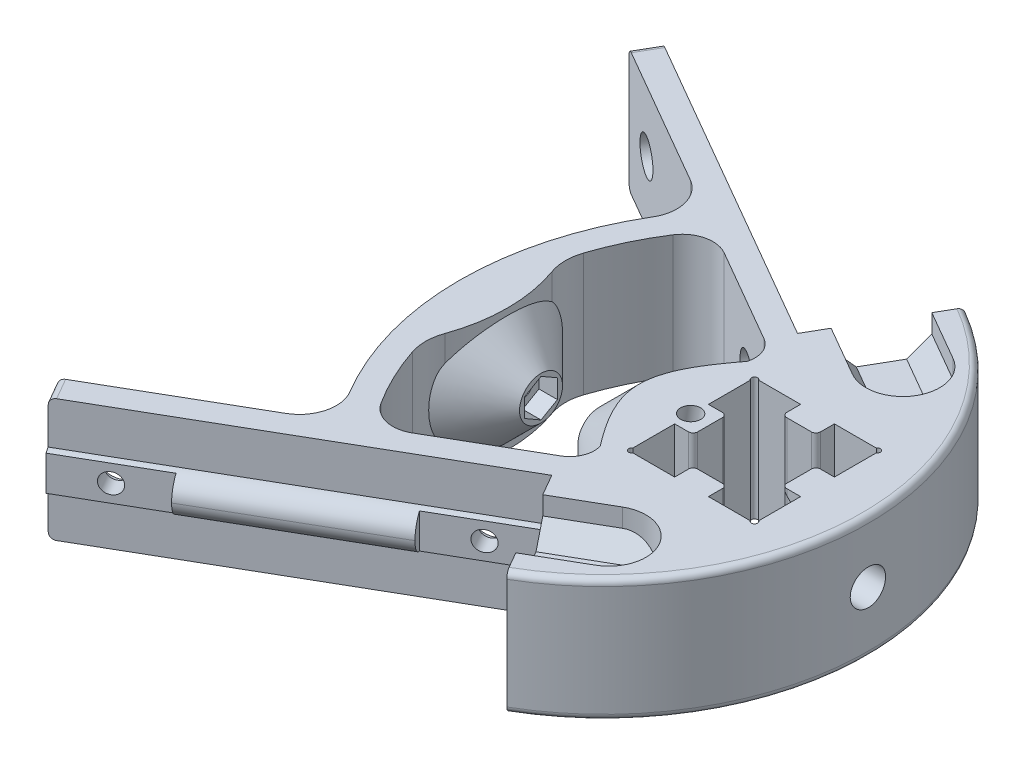
from build123d import *

# Parameters (mm, degrees)
BOSS_EXTRUDE1_DEPTH      = 10
BOSS_EXTRUDE1_DEPTH_BACK = 10
CUT_EXTRUDE1_DEPTH       = 85.16558516883241
CUT_EXTRUDE1_DEPTH_BACK  = 85.16558516883241
CUT_EXTRUDE2_DEPTH       = 15.5
FILLET1_R                = 6
BOSS_EXTRUDE2_DEPTH      = 3
SKETCH7_W                = 15.499999999999996
SKETCH7_H                = 6.0000000000000275
CUT_EXTRUDE6_DEPTH       = 2
SKETCH8_R                = 1.6250000000000036
SKETCH8_R_2              = 1.6250000000000004
CUT_EXTRUDE7_DEPTH       = 91.43091285616889
SKETCH9_R                = 2.8750000000000013
SKETCH9_R_2              = 2.874999999999998
CUT_EXTRUDE8_DEPTH       = 2
FILLET3_R                = 3
FILLET3_OF_MIRROR4_R     = 3
SKETCH10_R               = 1.6250000000000004
CUT_EXTRUDE9_DEPTH       = 91.52459814041141
SKETCH11_W               = 5.500000000000943
SKETCH11_H               = 15.5
CUT_EXTRUDE11_DEPTH      = 2
SKETCH13_R               = 2.875
CUT_EXTRUDE12_DEPTH      = 7.297005384
CUT_EXTRUDE19_REACH      = 88.363
FILLET8_R                = 1
BOSS_EXTRUDE4_START      = -10
BOSS_EXTRUDE4_DEPTH      = 20
CUT_EXTRUDE16_DEPTH      = 15
CUT_EXTRUDE16_DEPTH_BACK = 76.53611051598217
SKETCH22_R               = 1.625
CUT_EXTRUDE17_DEPTH      = 3
CUT_EXTRUDE23_DEPTH      = 77.66001895829943
CUT_EXTRUDE18_START      = -8.260694126
SKETCH24_R               = 2.875
CUT_EXTRUDE18_DEPTH      = 8.260694126
BOSS_EXTRUDE5_REACH      = 86.786
SKETCH26_R               = 3.5
SKETCH33_W               = 3.175991156796007
SKETCH33_H               = 3.160348597481216
SKETCH33_W_2             = 2.9170878472882418
SKETCH33_H_2             = 3.188535845757045
CUT_EXTRUDE24_DEPTH      = 87.43609356738901


with BuildPart() as part:
    # Sketch-main → Boss-Extrude1 (new, two sides: drawn at the far end of the back side and taken through both)
    with BuildSketch(Plane(origin=(0, 0, 0), x_dir=(1, 0, 0), z_dir=(0, 1, 0)).offset(-BOSS_EXTRUDE1_DEPTH_BACK)):
        with BuildLine():
            Line((-13.000000000000002, 20), (-64.96152422706649, 49.99999999999968))
            Line((-64.96152422706649, 49.99999999999968), (-66.96152422706649, 46.53589838486192))
            Line((-66.96152422706649, 46.53589838486192), (-15.004001400732033, 16.538208594652033))
            ThreePointArc((-15.004001400732033, 16.538208594652033), (-13.123100608335006, 14.042925352364557), (-13.610574402880538, 10.956406998343017))
            ThreePointArc((-13.610574402880538, 10.956406998343017), (-16.748819076269225, -6.66e-15), (-13.610574402880461, -10.956406998342983))
            ThreePointArc((-13.610574402880461, -10.956406998342983), (-13.12310060833493, -14.042925352364582), (-15.004001400732033, -16.538208594652033))
            Line((-15.004001400732033, -16.538208594652033), (-66.96152422706648, -46.53589838486191))
            Line((-66.96152422706648, -46.53589838486191), (-64.96152422706649, -49.99999999999968))
            Line((-64.96152422706649, -49.99999999999968), (-13.000000000000002, -20))
            Line((-13.000000000000002, -20), (-3.0000000000001115, -37.320508075688835))
            ThreePointArc((-3.0000000000001115, -37.320508075688835), (18.547005383792598, -9.57e-15), (-3.0000000000001066, 37.320508075688835))
            Line((-3.0000000000001066, 37.320508075688835), (-13.000000000000002, 20))
        make_face()
    extrude(amount=BOSS_EXTRUDE1_DEPTH + BOSS_EXTRUDE1_DEPTH_BACK)

    # Sketch-extrusion profile → Cut-Extrude1 (cut, two sides: drawn at the far end of the back side and taken through both)
    with BuildSketch(Plane(origin=(0, 0, 0), x_dir=(1, 0, 0), z_dir=(0, 1, 0)).offset(-CUT_EXTRUDE1_DEPTH_BACK)):
        with BuildLine():
            Line((10.250000000000622, 2.75000000000047), (10.250000000000616, 9.566987298108355))
            ThreePointArc((10.250000000000616, 9.566987298108355), (10.353553390593937, 10.353553390593861), (9.566987298108396, 10.250000000000574))
            Line((9.566987298108396, 10.250000000000574), (2.7500000000005236, 10.250000000000599))
            Line((2.7500000000005236, 10.250000000000599), (2.7500000000005236, 8.000000000000595))
            ThreePointArc((2.7500000000005236, 8.000000000000595), (2.5303300858904327, 7.469669914110679), (2.000000000000515, 7.2500000000005915))
            Line((2.000000000000515, 7.2500000000005915), (0, 7.2500000000005995))
            Line((0, 7.2500000000005995), (-2.0000000000004903, 7.2500000000005995))
            ThreePointArc((-2.0000000000004903, 7.2500000000005995), (-2.5303300858904065, 7.469669914110688), (-2.750000000000498, 8.000000000000604))
            Line((-2.750000000000498, 8.000000000000604), (-2.750000000000498, 10.250000000000611))
            Line((-2.750000000000498, 10.250000000000611), (-9.56698729810839, 10.250000000000611))
            ThreePointArc((-9.56698729810839, 10.250000000000611), (-10.353553390593884, 10.353553390593884), (-10.250000000000611, 9.56698729810839))
            Line((-10.250000000000611, 9.56698729810839), (-10.25000000000061, 2.750000000000496))
            Line((-10.25000000000061, 2.750000000000496), (-8.000000000000606, 2.750000000000496))
            ThreePointArc((-8.000000000000606, 2.750000000000496), (-7.469669914110688, 2.5303300858904074), (-7.250000000000598, 2.000000000000491))
            Line((-7.250000000000598, 2.000000000000491), (-7.250000000000598, -1.73e-15))
            Line((-7.250000000000598, -1.73e-15), (-7.250000000000598, -2.0000000000004174))
            ThreePointArc((-7.250000000000598, -2.0000000000004174), (-7.4696699141107, -2.5303300858903466), (-8.000000000000634, -2.7500000000004134))
            Line((-8.000000000000634, -2.7500000000004134), (-10.250000000000645, -2.7500000000004134))
            Line((-10.250000000000645, -2.7500000000004134), (-10.250000000000645, -9.566987298108245))
            ThreePointArc((-10.250000000000645, -9.566987298108245), (-10.35355339059406, -10.353553390593706), (-9.566987298108558, -10.250000000000615))
            Line((-9.566987298108558, -10.250000000000615), (-2.750000000000581, -10.250000000000577))
            Line((-2.750000000000581, -10.250000000000577), (-2.750000000000581, -8.000000000000574))
            ThreePointArc((-2.750000000000581, -8.000000000000574), (-2.530330085890485, -7.469669914110661), (-2.0000000000005667, -7.250000000000577))
            Line((-2.0000000000005667, -7.250000000000577), (-4.888e-14, -7.2500000000005995))
            Line((-4.888e-14, -7.2500000000005995), (2.000000000000441, -7.2500000000005995))
            ThreePointArc((2.000000000000441, -7.2500000000005995), (2.5303300858903652, -7.469669914110696), (2.7500000000004414, -8.000000000000624))
            Line((2.7500000000004414, -8.000000000000624), (2.7500000000004414, -10.250000000000632))
            Line((2.7500000000004414, -10.250000000000632), (9.566987298108364, -10.250000000000648))
            ThreePointArc((9.566987298108364, -10.250000000000648), (10.353553390593767, -10.353553390593923), (10.25000000000058, -9.56698729810843))
            Line((10.25000000000058, -9.56698729810843), (10.250000000000588, -2.7500000000005516))
            Line((10.250000000000588, -2.7500000000005516), (8.000000000000584, -2.7500000000005516))
            ThreePointArc((8.000000000000584, -2.7500000000005516), (7.46966991411067, -2.5303300858904585), (7.250000000000585, -2.0000000000005405))
            Line((7.250000000000585, -2.0000000000005405), (7.2500000000005995, -2.444e-14))
            Line((7.2500000000005995, -2.444e-14), (7.2500000000005995, 2.000000000000466))
            ThreePointArc((7.2500000000005995, 2.000000000000466), (7.469669914110693, 2.530330085890386), (8.000000000000615, 2.7500000000004694))
            Line((8.000000000000615, 2.7500000000004694), (10.250000000000622, 2.75000000000047))
        make_face()
    extrude(amount=CUT_EXTRUDE1_DEPTH + CUT_EXTRUDE1_DEPTH_BACK, mode=Mode.SUBTRACT)

    # Sketch1 → Cut-Extrude2 (cut)
    with BuildSketch(Plane(origin=(-18.410254037844403, 0, -10.629165124598712), x_dir=(-0.4999999999999947, 0, 0.8660254037844417), z_dir=(-0.8660254037844418, 0, -0.49999999999999484))):
        Polygon((-17.820508075688895, 4), (-23.82050807568889, 4), (-26.820508075688892, 6.999999999999999), (-26.820508075688892, 9.999999999999998), (-14.820508075688894, 10), (-14.820508075688892, 7.000000000000001), align=None)
        Polygon((-23.820508075688885, -4), (-26.82050807568889, -7.000000000000003), (-26.820508075688892, -9.999999999999998), (-14.820508075688888, -9.999999999999996), (-14.820508075688892, -7.000000000000001), (-17.820508075688895, -4), align=None)
    cut_extrude2 = extrude(amount=-CUT_EXTRUDE2_DEPTH, mode=Mode.SUBTRACT)

    # Mirror1: Cut-Extrude2 across plane
    add(cut_extrude2.mirror(Plane.XY), mode=Mode.SUBTRACT)

    # Fillet1
    fillet1_edges = [part.edges().sort_by_distance(p)[0] for p in [
        (2.4233937586588157, -8.499999999999998, 15.71410161513785),
        (8.423393758658756, -8.5, 26.10640646055115),
        (2.4233937586588175, 8.5, 15.71410161513785),
        (8.423393758658756, 8.499999999999998, 26.10640646055115),
        (2.423393758658812, -8.499999999999998, -15.714101615137842),
        (8.423393758658749, -8.5, -26.106406460551145),
        (8.423393758658749, 8.499999999999998, -26.106406460551145),
        (2.423393758658813, 8.5, -15.714101615137844),
    ]]
    fillet(fillet1_edges, radius=FILLET1_R - 0.0001)  # a hair under: the kernel refuses the full size

    # Sketch3 → Boss-Extrude2 (add)
    with BuildSketch(Plane(origin=(5.410254037844397, 0, -9.370834875401297), x_dir=(-0.8660254037844417, 0, -0.4999999999999947), z_dir=(0.49999999999999484, 0, -0.8660254037844418))):
        Polygon((21.25833024919736, -3.000000000000001), (81.25833024919763, -3.000000000000001), (81.25833024919763, 3.0000000000000053), (21.25833024919736, 3.000000000000026), align=None)
    boss_extrude2 = extrude(amount=BOSS_EXTRUDE2_DEPTH)

    # Sketch7 → Cut-Extrude6 (cut)
    with BuildSketch(Plane(origin=(6.910254037844382, 0, -11.968911086754629), x_dir=(-0.8660254037844416, 0, -0.49999999999999484), z_dir=(0.49999999999999484, 0, -0.8660254037844416))):
        with Locations((29.00833024919735, 1.288e-14)):
            Rectangle(SKETCH7_W, SKETCH7_H)
        Polygon((81.25833024919761, -3.000000000000001), (65.75833024919763, -2.9999999999999973), (65.75833024919763, 3.0000000000000298), (81.25833024919763, 3.0000000000000053), align=None)
    cut_extrude6 = extrude(amount=-CUT_EXTRUDE6_DEPTH, mode=Mode.SUBTRACT)

    # Sketch8 → Cut-Extrude7 (cut, through all)
    with BuildSketch(Plane(origin=(3.4102540378444237, 0, -5.906733260263541), x_dir=(0.8660254037844417, 0, 0.4999999999999947), z_dir=(-0.49999999999999484, 0, 0.8660254037844418))):
        with Locations((-73.5083302491976, 3.47e-15)):
            Circle(SKETCH8_R)
        with Locations(Location((-29.008330249197357, 3.47e-15, 0), (0, 0, 180))):
            Circle(SKETCH8_R_2)
    cut_extrude7 = extrude(amount=-CUT_EXTRUDE7_DEPTH, mode=Mode.SUBTRACT)

    # Sketch9 → Cut-Extrude8 (cut)
    with BuildSketch(Plane(origin=(3.4102540378444237, 0, -5.906733260263541), x_dir=(0.8660254037844417, 0, 0.4999999999999947), z_dir=(-0.49999999999999484, 0, 0.8660254037844418))):
        with Locations((-73.50833024919758, 3.47e-15)):
            Circle(SKETCH9_R)
        with Locations((-29.008330249197357, 3.47e-15)):
            Circle(SKETCH9_R_2)
    cut_extrude8 = extrude(amount=-CUT_EXTRUDE8_DEPTH, mode=Mode.SUBTRACT)

    # Fillet3
    fillet3_edges = [part.edges().sort_by_distance(p)[0] for p in [
        (-37.48076211353314, -3.000000000000001, -37.598076211353096),
        (-37.48076211353313, 3.000000000000016, -37.598076211353096),
    ]]
    fillet(fillet3_edges, radius=FILLET3_R - 0.0001)  # a hair under: the kernel refuses the full size

    # Mirror4: Boss-Extrude2, Cut-Extrude6, Cut-Extrude7, Cut-Extrude8 across plane
    add(boss_extrude2.mirror(Plane.XY))
    add(cut_extrude6.mirror(Plane.XY), mode=Mode.SUBTRACT)
    add(cut_extrude7.mirror(Plane.XY), mode=Mode.SUBTRACT)
    add(cut_extrude8.mirror(Plane.XY), mode=Mode.SUBTRACT)

    # Fillet3 of Mirror4
    fillet3_of_mirror4_edges = [part.edges().sort_by_distance(p)[0] for p in [
        (-37.48076211353314, -3.000000000000001, 37.598076211353096),
        (-37.48076211353313, 3.000000000000016, 37.5980762113531),
    ]]
    fillet(fillet3_of_mirror4_edges, radius=FILLET3_OF_MIRROR4_R - 0.0001)  # a hair under: the kernel refuses the full size

    # Sketch10 → Cut-Extrude9 (cut, through all)
    with BuildSketch(Plane.ZY.offset(-7.2500000000005995)):
        Circle(SKETCH10_R)
    extrude(amount=-CUT_EXTRUDE9_DEPTH, mode=Mode.SUBTRACT)

    # Sketch11 → Cut-Extrude11 (cut)
    with BuildSketch(Plane.ZY.offset(-7.2500000000005995)):
        Rectangle(SKETCH11_W, SKETCH11_H)
    extrude(amount=-CUT_EXTRUDE11_DEPTH, mode=Mode.SUBTRACT)

    # Sketch13 → Cut-Extrude12 (cut)
    with BuildSketch(Plane(origin=(18.547005383792595, 10, 1.221e-14), x_dir=(2.06e-15, 0, -1), z_dir=(1, 0, 2.06e-15))):
        with Locations((9.76e-15, -10.000000000000002)):
            Circle(SKETCH13_R)
    extrude(amount=-CUT_EXTRUDE12_DEPTH, mode=Mode.SUBTRACT)

    # Sketch27 → Cut-Extrude19 (cut, up to next)
    with BuildSketch(Plane.XY.offset(2.7500000000005516), mode=Mode.PRIVATE) as cut_extrude19_sk1:
        Polygon((9.2500000000006, 7.749999999999998), (8.000000000000606, 7.749999999999998), (7.2500000000005995, 7.749999999999998), (7.2500000000005995, 9.749999999999975), align=None)
    cut_extrude19_tool1 = extrude(cut_extrude19_sk1.sketch, amount=-CUT_EXTRUDE19_REACH, mode=Mode.PRIVATE) & part.part
    # Sketch27 → Cut-Extrude19 (cut, up to next)
    with BuildSketch(Plane.XY.offset(2.7500000000005516), mode=Mode.PRIVATE) as cut_extrude19_sk2:
        Polygon((9.2500000000006, -7.750000000000002), (8.000000000000606, -7.750000000000002), (7.2500000000005995, -7.750000000000002), (7.2500000000005995, -9.74999999999998), align=None)
    cut_extrude19_tool2 = extrude(cut_extrude19_sk2.sketch, amount=-CUT_EXTRUDE19_REACH, mode=Mode.PRIVATE) & part.part
    add(cut_extrude19_tool1.solids().sort_by_distance((7.916667, 8.416667, 2.75))[0], mode=Mode.SUBTRACT)
    add(cut_extrude19_tool2.solids().sort_by_distance((7.916667, -8.416667, 2.75))[0], mode=Mode.SUBTRACT)

    # Fillet8
    fillet8_edges = [part.edges().sort_by_distance(p)[0] for p in [
        (-65.96152422706649, -10, -48.267949192430805),
        (-65.96152422706649, -10, 48.26794919243079),
        (-65.96152422706649, 10, -48.267949192430805),
        (-65.96152422706649, 10, 48.26794919243079),
        (18.547005383792587, 10, 7.11e-15),
        (18.547005383792587, -10, 7.11e-15),
    ]]
    fillet(fillet8_edges, radius=FILLET8_R)

    # Sketch20 → Boss-Extrude4 (add)
    with BuildSketch(Plane(origin=(0, 0, 0), x_dir=(1, 0, 0), z_dir=(0, 1, 0)).offset(BOSS_EXTRUDE4_START)):
        with BuildLine():
            Line((-30.337190382378104, 25.390829380740374), (-24.551646039791162, 22.05054379713929))
            Line((-24.551646039791162, 22.05054379713929), (-22.551646039791173, 25.514645412277034))
            Line((-22.551646039791173, 25.514645412277034), (-45.50963342003208, 38.76944560631115))
            Line((-45.50963342003208, 38.76944560631115), (-47.509633420032074, 35.3053439911734))
            Line((-47.509633420032074, 35.3053439911734), (-43.35898141497715, 32.90896393874249))
            ThreePointArc((-43.35898141497715, 32.90896393874249), (-40.55179770442273, 29.221657880604262), (-41.20900337837442, 24.63421991881005))
            ThreePointArc((-41.20900337837442, 24.63421991881005), (-48.01069412586296, -5.88e-15), (-41.20900337837442, -24.63421991881005))
            ThreePointArc((-41.20900337837442, -24.63421991881005), (-40.55179770442273, -29.221657880604262), (-43.35898141497715, -32.90896393874249))
            Line((-43.35898141497715, -32.90896393874249), (-47.509633420032074, -35.3053439911734))
            Line((-47.509633420032074, -35.3053439911734), (-45.50963342003208, -38.76944560631115))
            Line((-45.50963342003208, -38.76944560631115), (-22.551646039791173, -25.514645412277034))
            Line((-22.551646039791173, -25.514645412277034), (-24.551646039791162, -22.05054379713929))
            Line((-24.551646039791162, -22.05054379713929), (-30.337190382378104, -25.390829380740374))
            ThreePointArc((-30.337190382378104, -25.390829380740374), (-34.018210471552706, -25.919219784753494), (-37.0459325129889, -23.760052223918628))
            ThreePointArc((-37.0459325129889, -23.760052223918628), (-39.701818027744096, -18.992283768208658), (-41.747188207516544, -13.9324611683098))
            ThreePointArc((-41.747188207516544, -13.9324611683098), (-42.15822288770385, -11.31872673327626), (-41.69423296681552, -8.713871543729091))
            ThreePointArc((-41.69423296681552, -8.713871543729091), (-40.18764638225842, 0), (-41.69423296681552, 8.713871543729091))
            ThreePointArc((-41.69423296681552, 8.713871543729091), (-42.15822288770385, 11.31872673327626), (-41.747188207516544, 13.9324611683098))
            ThreePointArc((-41.747188207516544, 13.9324611683098), (-39.701818027744096, 18.992283768208658), (-37.0459325129889, 23.760052223918628))
            ThreePointArc((-37.0459325129889, 23.760052223918628), (-34.018210471552706, 25.919219784753494), (-30.337190382378104, 25.390829380740374))
        make_face()
    extrude(amount=BOSS_EXTRUDE4_DEPTH)

    # Sketch21 → Revolve1 (revolve)
    with BuildSketch(Plane(origin=(0, 0, 0), x_dir=(1, 0, 0), z_dir=(0, 1, 0)), mode=Mode.PRIVATE) as revolve1_sk:
        Polygon((-34.74999999999999, 0), (-34.74999999999999, 3.5), (-42.142529340270016, 10.892529340269935), (-42.14252934027001, -8.7e-16), align=None)
        Polygon((-25.25, 0), (-25.25, 3.5), (-12.0832470279454, 16.6667529720546), (-12.083247027945399, 0), align=None)
    revolve(revolve1_sk.sketch.rotate(Axis((-34.74999999999999, 0, 0), (1, 0, 0)), 180), axis=Axis((-34.74999999999999, 0, 0), (1, 0, 0)))

    # Sketch22 → Cut-Extrude16 (cut, two sides: drawn at the far end of the back side and taken through both)
    with BuildSketch(Plane(origin=(-34.74999999999999, 0, 0), x_dir=(0, 0, -1), z_dir=(1, 0, 0)).offset(-CUT_EXTRUDE16_DEPTH_BACK)):
        with Locations(Location((0, 0, 0), (0, 0, 180))):
            Circle(SKETCH22_R)
    extrude(amount=CUT_EXTRUDE16_DEPTH + CUT_EXTRUDE16_DEPTH_BACK, mode=Mode.SUBTRACT)

    # Sketch23 → Cut-Extrude17 (cut)
    with BuildSketch(Plane(origin=(-34.74999999999999, 0, 0), x_dir=(0, 0, -1), z_dir=(1, 0, 0))):
        Polygon((-4.3e-16, 3.0750000000000006), (-2.6630281166371486, 1.5375000000000005), (-2.663028116637148, -1.5375), (-4.2e-16, -3.0749999999999997), (2.663028116637148, -1.5375000000000003), (2.6630281166371477, 1.5375000000000012), align=None)
    extrude(amount=-CUT_EXTRUDE17_DEPTH, mode=Mode.SUBTRACT)

    # Sketch32 → Cut-Extrude23 (cut, through all)
    with BuildSketch(Plane(origin=(-12.0832470279454, 0, 0), x_dir=(0, 0, -1), z_dir=(1, 0, 0))):
        with BuildLine():
            Line((-13.333441214911131, 10), (13.333441214911131, 10))
            ThreePointArc((13.333441214911131, 10), (1.02e-15, 16.6667529720546), (-13.333441214911131, 10))
        make_face()
        with BuildLine():
            Line((13.333441214911131, -10), (-13.333441214911131, -10))
            ThreePointArc((-13.333441214911131, -10), (1.02e-15, -16.6667529720546), (13.333441214911131, -10))
        make_face()
    extrude(amount=-CUT_EXTRUDE23_DEPTH, mode=Mode.SUBTRACT)

    # Sketch24 → Cut-Extrude18 (cut)
    with BuildSketch(Plane(origin=(-48.010694125862955, 10.00000000000005, 8.82e-15), x_dir=(1.8e-16, 0, 1), z_dir=(-1, -6.4e-16, 1.8e-16)).offset(CUT_EXTRUDE18_START)):
        with Locations(Location((-1.23e-14, -10.000000000000036, 0), (0, 0, 180))):
            Circle(SKETCH24_R)
    extrude(amount=CUT_EXTRUDE18_DEPTH, mode=Mode.SUBTRACT)

    # Sketch25 → Cut-Revolve1 (revolve, cut)
    with BuildSketch(Plane.XY, mode=Mode.PRIVATE) as cut_revolve1_sk:
        Polygon((-10.052066546836105, 12.379799843205491), (-11.660266176457434, 12.612864107488761), (-13.76906959250945, -1.938388024915085), (-15.377269222130744, -1.7053237606318215), (-17.436261006973268, -15.912863625055406), (-14.21986174773066, -16.378992153621937), align=None)
    revolve(cut_revolve1_sk.sketch.rotate(Axis((-14.21986174773066, -16.378992153621937, 0), (0.14342416263585614, 0.9896613105361872, 0)), 180), axis=Axis((-14.21986174773066, -16.378992153621937, 0), (0.14342416263585614, 0.9896613105361872, 0)), mode=Mode.SUBTRACT)

    # Boss-Extrude5: up to this plane
    boss_extrude5_end = Plane(origin=(-24.54700538379235, -10, 0), z_dir=(0, -1, 0))
    # Sketch26 → Boss-Extrude5 (add, up to the surface)
    with BuildSketch(Plane(origin=(-0.5583739171692206, -3.852914686613374, 0), x_dir=(0.9896613105361872, -0.14342416263585617, 0), z_dir=(-0.14342416263585614, -0.9896613105361871, 0)), mode=Mode.PRIVATE) as boss_extrude5_sk1:
        with Locations((-11.723703778450037, 0)):
            Circle(SKETCH26_R)
        Polygon((-11.723703778450036, 3.2500000000000013), (-14.53828634074946, 1.6250000000000013), (-14.53828634074946, -1.624999999999997), (-11.72370377845003, -3.2499999999999987), (-8.909121216150611, -1.625000000000002), (-8.909121216150611, 1.625000000000001), align=None, mode=Mode.SUBTRACT)
    boss_extrude5_tool1 = split(extrude(boss_extrude5_sk1.sketch, amount=BOSS_EXTRUDE5_REACH, mode=Mode.PRIVATE), bisect_by=boss_extrude5_end, keep=Keep.BOTH, mode=Mode.PRIVATE)
    add(boss_extrude5_tool1.solids().sort_by_distance((-15.526713, -1.683666, 0))[0])

    # Sketch33 → Cut-Extrude24 (cut, through all)
    with BuildSketch(Plane.XZ.offset(10)):
        with Locations((-8.662004421602642, 4.330174298741022)):
            Rectangle(SKETCH33_W, SKETCH33_H)
        with Locations((-8.79145607635649, -4.344267922879019)):
            Rectangle(SKETCH33_W_2, SKETCH33_H_2)
    extrude(amount=-CUT_EXTRUDE24_DEPTH, mode=Mode.SUBTRACT)


solid = part.part
